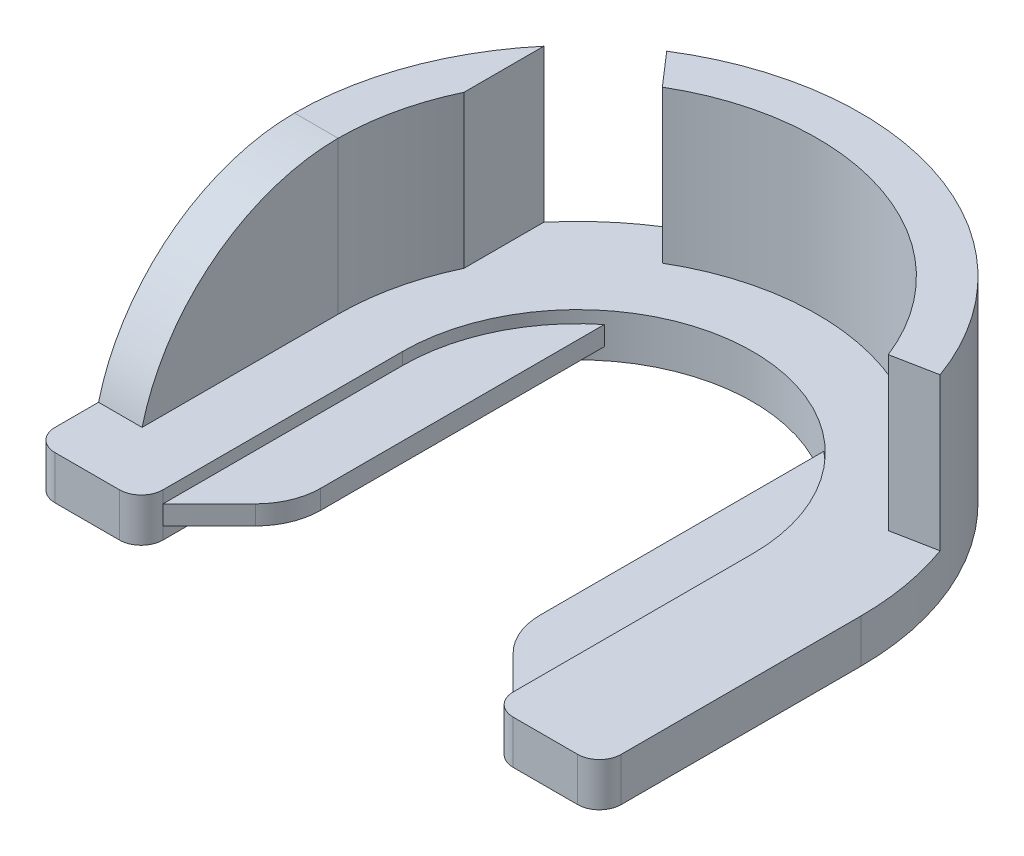
from build123d import *

# Parameters (mm, degrees)
BOSS_EXTRUDE1_DEPTH      = 2.2
BOSS_EXTRUDE1_2_DEPTH    = 2.2
BOSS_EXTRUDE2_DEPTH      = 5
BOSS_EXTRUDE3_DEPTH      = 40
BOSS_EXTRUDE3_DEPTH_BACK = 5
CUT_EXTRUDE1_DEPTH       = 101.249688279
CUT_EXTRUDE1_DEPTH_BACK  = 101.249688279
CUT_EXTRUDE2_START       = -35
CUT_EXTRUDE2_DEPTH       = 35


with BuildPart() as part:
    # Sketch3 → Boss-Extrude1 (new, symmetric)
    with BuildSketch(Plane(origin=(0, 0, 0), x_dir=(1, 0, 0), z_dir=(0, 1, 0))):
        with BuildLine():
            Line((40.2, -55), (40.2, 0))
            ThreePointArc((40.2, 0), (36.256585609, 17.363755354), (25.2, 31.320919527))
            Line((25.2, 31.320919527), (25.2, -33.786796564))
            ThreePointArc((25.2, -33.786796564), (26.341807012, -39.52704805), (29.593398282, -44.393398282))
            Line((29.593398282, -44.393398282), (40.2, -55))
        make_face()
    extrude(amount=BOSS_EXTRUDE1_DEPTH, both=True)



with BuildPart() as body_2:
    # Sketch3 → Boss-Extrude1 2 (new, symmetric)
    with BuildSketch(Plane(origin=(0, 0, 0), x_dir=(1, 0, 0), z_dir=(0, 1, 0))):
        with BuildLine():
            ThreePointArc((-25.2, 31.320919527), (-36.256585609, 17.363755354), (-40.2, 0))
            Line((-40.2, 0), (-40.2, -55))
            Line((-40.2, -55), (-29.593398282, -44.393398282))
            ThreePointArc((-29.593398282, -44.393398282), (-26.341807012, -39.52704805), (-25.2, -33.786796564))
            Line((-25.2, -33.786796564), (-25.2, 31.320919527))
        make_face()
    extrude(amount=BOSS_EXTRUDE1_2_DEPTH, both=True)


with BuildPart() as part_1:
    add(part.part)

    add(body_2.part)  # Boss-Extrude2 merges body 2
    # Sketch3<3> → Boss-Extrude2 (add, symmetric)
    with BuildSketch(Plane(origin=(0, 0, 0), x_dir=(1, 0, 0), z_dir=(0, 1, 0))):
        with BuildLine():
            Line((54.99875244, -60), (54.99875244, 0))
            ThreePointArc((54.99875244, 0), (0, 54.99875244), (-54.99875244, 0))
            Line((-54.99875244, 0), (-54.99875244, -60))
            Line((-54.99875244, -60), (-45.2, -60))
            ThreePointArc((-45.2, -60), (-41.664466094, -58.535533906), (-40.2, -55))
            Line((-40.2, -55), (-40.2, 0))
            ThreePointArc((-40.2, 0), (0, 40.2), (40.2, 0))
            Line((40.2, 0), (40.2, -55))
            ThreePointArc((40.2, -55), (41.664466094, -58.535533906), (45.2, -60))
            Line((45.2, -60), (54.99875244, -60))
        make_face()
    extrude(amount=BOSS_EXTRUDE2_DEPTH, both=True)

    # Sketch3<4> → Boss-Extrude3 (add, two sides: drawn at the far end of the back side and taken through both)
    with BuildSketch(Plane(origin=(0, 0, 0), x_dir=(1, 0, 0), z_dir=(0, 1, 0)).offset(-BOSS_EXTRUDE3_DEPTH_BACK)):
        with BuildLine():
            Line((65, -55), (65, 0))
            ThreePointArc((65, 0), (0, 65), (-65, 0))
            Line((-65, 0), (-65, -55))
            ThreePointArc((-65, -55), (-63.535533906, -58.535533906), (-60, -60))
            Line((-60, -60), (-54.99875244, -60))
            Line((-54.99875244, -60), (-54.99875244, 0))
            ThreePointArc((-54.99875244, 0), (0, 54.99875244), (54.99875244, 0))
            Line((54.99875244, 0), (54.99875244, -60))
            Line((54.99875244, -60), (60, -60))
            ThreePointArc((60, -60), (63.535533906, -58.535533906), (65, -55))
        make_face()
    extrude(amount=BOSS_EXTRUDE3_DEPTH + BOSS_EXTRUDE3_DEPTH_BACK)

    # Sketch4 → Cut-Extrude1 (cut, two sides: drawn at the far end of the back side and taken through both)
    with BuildSketch(Plane(origin=(0, 0, 0), x_dir=(0, 0, -1), z_dir=(1, 0, 0)).offset(-CUT_EXTRUDE1_DEPTH_BACK)):
        with BuildLine():
            Line((-45, 5), (-60, 5))
            Line((-60, 5), (-60, 40))
            Line((-60, 40), (0, 40))
            ThreePointArc((0, 40), (-28.504385627, 30.219924378), (-45, 5))
        make_face()
    extrude(amount=CUT_EXTRUDE1_DEPTH + CUT_EXTRUDE1_DEPTH_BACK, mode=Mode.SUBTRACT)

    # Sketch5 → Cut-Extrude2 (cut)
    with BuildSketch(Plane(origin=(0, 40, 0), x_dir=(1, 0, 0), z_dir=(0, 1, 0)).offset(CUT_EXTRUDE2_START)):
        with BuildLine():
            Line((-34.589058261, 55.032690726), (-27.933888882, 47.376794128))
            ThreePointArc((-27.933888882, 47.376794128), (-36.082428121, 41.508085367), (-43.028080487, 34.255613548))
            ThreePointArc((-43.028080487, 34.255613548), (-46.661464263, 29.113064469), (-49.683249866, 23.588926485))
            Line((-49.683249866, 23.588926485), (-49.683249866, 41.911510147))
            ThreePointArc((-49.683249866, 41.911510147), (-42.643836884, 49.056122714), (-34.589058261, 55.032690726))
        make_face()
        with BuildLine():
            Line((51.180271798, 20.135604003), (61.138057431, 22.071201453))
            ThreePointArc((61.138057431, 22.071201453), (64.02723535, 11.203264413), (65, 0))
            Line((65, 0), (65, -45))
            Line((65, -45), (54.99875244, -45))
            Line((54.99875244, -45), (54.99875244, 0))
            ThreePointArc((54.99875244, 0), (54.035700552, 10.247235517), (51.180271798, 20.135604003))
        make_face()
    extrude(amount=CUT_EXTRUDE2_DEPTH, mode=Mode.SUBTRACT)


solid = part_1.part
